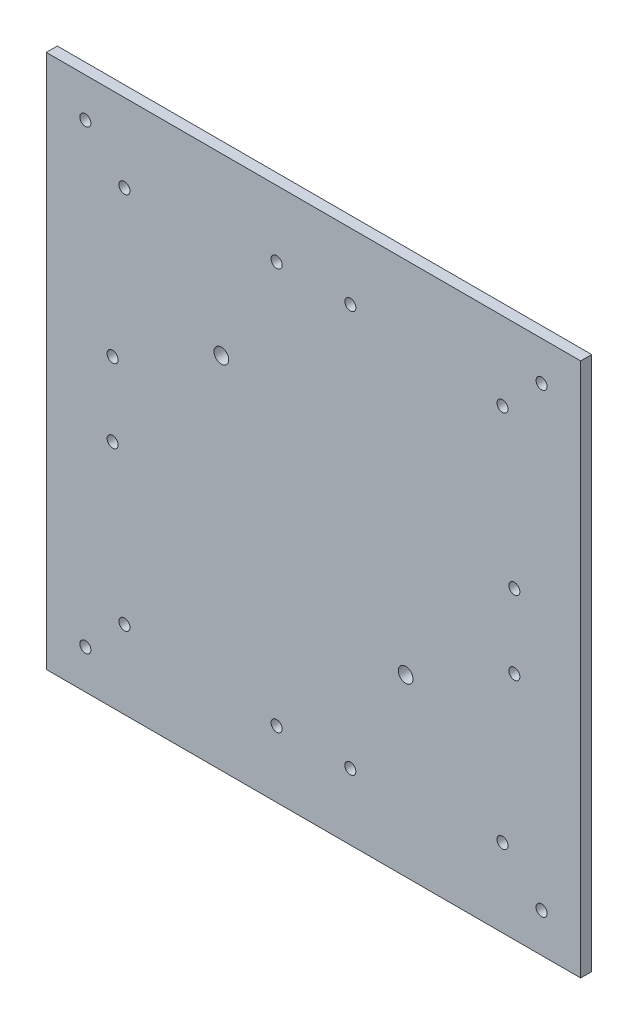
from build123d import *

# Parameters (mm, degrees)
SKETCH_1_W          = 145
SKETCH_1_H          = 145
EXTRUDE_1_DEPTH     = 3
SKETCH_2_R          = 1.5
CUT_EXTRUDE_2_DEPTH = 3
SKETCH_3_R          = 1.5
CUT_EXTRUDE_3_DEPTH = 3
SKETCH_5_R          = 2
CUT_EXTRUDE_4_DEPTH = 3


with BuildPart() as part:
    # 草图1 → 凸台-拉伸1 (new body)
    with BuildSketch(Plane.XY):
        Rectangle(SKETCH_1_W, SKETCH_1_H)
    extrude(amount=EXTRUDE_1_DEPTH)

    # 草图2 → 切除-拉伸2 (cut)
    with BuildSketch(Plane.XY.offset(3)):
        with Locations((-54.5, -10)):
            Circle(SKETCH_2_R)
        with Locations((-54.5, 10)):
            Circle(SKETCH_2_R)
        with Locations((10, 54.5)):
            Circle(SKETCH_2_R)
        with Locations((-10, 54.5)):
            Circle(SKETCH_2_R)
        with Locations((54.5, -10)):
            Circle(SKETCH_2_R)
        with Locations((54.5, 10)):
            Circle(SKETCH_2_R)
        with Locations((-10, -54.5)):
            Circle(SKETCH_2_R)
        with Locations((10, -54.5)):
            Circle(SKETCH_2_R)
    extrude(amount=-CUT_EXTRUDE_2_DEPTH, mode=Mode.SUBTRACT)

    # 草图3 → 切除-拉伸3 (cut)
    with BuildSketch(Plane.XY.offset(3)):
        with Locations((-61.893398282, 61.893398282)):
            Circle(SKETCH_3_R)
        with Locations((-51.286796564, 51.286796564)):
            Circle(SKETCH_3_R)
        with Locations((61.893398282, 61.893398282)):
            Circle(SKETCH_3_R)
        with Locations((51.286796564, 51.286796564)):
            Circle(SKETCH_3_R)
        with Locations((61.893398282, -61.893398282)):
            Circle(SKETCH_3_R)
        with Locations((51.286796564, -51.286796564)):
            Circle(SKETCH_3_R)
        with Locations((-61.893398282, -61.893398282)):
            Circle(SKETCH_3_R)
        with Locations((-51.286796564, -51.286796564)):
            Circle(SKETCH_3_R)
    extrude(amount=-CUT_EXTRUDE_3_DEPTH, mode=Mode.SUBTRACT)

    # 草图5 → 切除-拉伸4 (cut)
    with BuildSketch(Plane.XY.offset(3)):
        with Locations((25, -25)):
            Circle(SKETCH_5_R)
        with Locations((-25, 25)):
            Circle(SKETCH_5_R)
    extrude(amount=-CUT_EXTRUDE_4_DEPTH, mode=Mode.SUBTRACT)


solid = part.part
